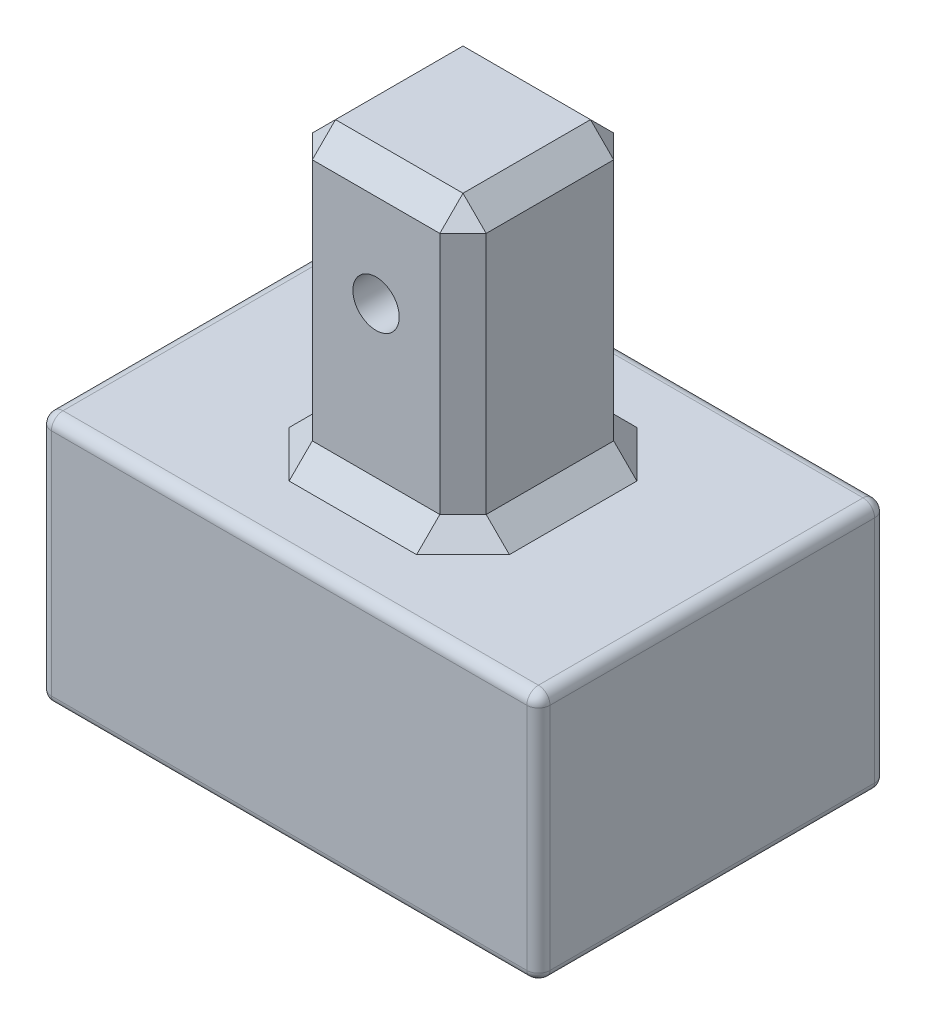
from build123d import *

# Parameters (mm, degrees)
MAIN_BODY_EXTRUDE_DEPTH        = 19.05
HINGE_START                    = -26.043353817
HINGE_SHELL_OUTLINE_W          = 26.043353817
HINGE_SHELL_OUTLINE_H          = 33.02
HINGE_SHELL_DEPTH              = 52.086707634
GROOVE_START                   = -16.51
GROOVE_1_DEPTH                 = 1.27
GROOVE_START_2                 = 17.78
GROOVE_2_DEPTH                 = 1.27
SKETCH5_W                      = 19.05
SKETCH5_H                      = 19.05
TIBIA_CONNECTION_EXTRUDE_DEPTH = 31.75
SKETCH6_R                      = 2.54
PINHOLE_CUT_DEPTH              = 25.4
FILLET1_R                      = 1.27
CHAMFER1_SIZE                  = 2.54
FILLET2_R                      = 0.889


# Read off the part's stored shape, not the designer's step: Hinge Shell
with BuildPart() as part:
    # Sketch1 → Main Body Extrude (new, symmetric)
    with BuildSketch(Plane.XY):
        with BuildLine():
            Line((18.423353817, 0), (-18.423353817, 0))
            ThreePointArc((-18.423353817, 0), (0, 18.423353817), (18.423353817, 0))
        make_face()
        with BuildLine():
            Line((18.423353817, 0), (21.598353817, 0))
            ThreePointArc((21.598353817, 0), (0, 21.598353817), (-21.598353817, 0))
            Line((-21.598353817, 0), (-18.423353817, 0))
            ThreePointArc((-18.423353817, 0), (0, 18.423353817), (18.423353817, 0))
        make_face()
        with BuildLine():
            Line((24.138353817, 0), (21.598353817, 0))
            ThreePointArc((21.598353817, 0), (0, 21.598353817), (-21.598353817, 0))
            Line((-21.598353817, 0), (-24.138353817, 0))
            ThreePointArc((-24.138353817, 0), (0, 24.138353817), (24.138353817, 0))
        make_face()
        with BuildLine():
            ThreePointArc((24.138353817, 0), (0, 24.138353817), (-24.138353817, 0))
            Line((-24.138353817, 0), (-24.773353817, 0))
            ThreePointArc((-24.773353817, 0), (0, 24.773353817), (24.773353817, 0))
            Line((24.773353817, 0), (24.138353817, 0))
        make_face()
        with BuildLine():
            Line((27.313353817, 0), (24.773353817, 0))
            ThreePointArc((24.773353817, 0), (0, 24.773353817), (-24.773353817, 0))
            Line((-24.773353817, 0), (-27.313353817, 0))
            ThreePointArc((-27.313353817, 0), (0, 27.313353817), (27.313353817, 0))
        make_face()
        with BuildLine():
            Line((-27.313353817, 27.313353817), (-27.313353817, 0))
            ThreePointArc((-27.313353817, 0), (-19.313457701, 19.313457701), (0, 27.313353817))
            Line((0, 27.313353817), (-27.313353817, 27.313353817))
        make_face()
        with BuildLine():
            Line((27.313353817, 27.313353817), (0, 27.313353817))
            ThreePointArc((0, 27.313353817), (19.313457701, 19.313457701), (27.313353817, 0))
            Line((27.313353817, 0), (27.313353817, 27.313353817))
        make_face()
    extrude(amount=MAIN_BODY_EXTRUDE_DEPTH, both=True)

    # Hinge Shell outline → Hinge Shell (cut)
    with BuildSketch(Plane.YZ.offset(HINGE_START)):
        with Locations((13.021676908, 0)):
            Rectangle(HINGE_SHELL_OUTLINE_W, HINGE_SHELL_OUTLINE_H)
    extrude(amount=HINGE_SHELL_DEPTH, mode=Mode.SUBTRACT)

    # Sketch1<13> → Groove 1 (cut)
    with BuildSketch(Plane.XY.offset(GROOVE_START)):
        with BuildLine():
            Line((18.423353817, 0), (21.598353817, 0))
            ThreePointArc((21.598353817, 0), (0, 21.598353817), (-21.598353817, 0))
            Line((-21.598353817, 0), (-18.423353817, 0))
            ThreePointArc((-18.423353817, 0), (0, 18.423353817), (18.423353817, 0))
        make_face()
    extrude(amount=-GROOVE_1_DEPTH, mode=Mode.SUBTRACT)

    # Sketch1<14> → Groove 2 (cut)
    with BuildSketch(Plane.XY.offset(GROOVE_START_2)):
        with BuildLine():
            Line((18.423353817, 0), (21.598353817, 0))
            ThreePointArc((21.598353817, 0), (0, 21.598353817), (-21.598353817, 0))
            Line((-21.598353817, 0), (-18.423353817, 0))
            ThreePointArc((-18.423353817, 0), (0, 18.423353817), (18.423353817, 0))
        make_face()
    extrude(amount=-GROOVE_2_DEPTH, mode=Mode.SUBTRACT)

    # Sketch5 → Tibia Connection Extrude (add)
    with BuildSketch(Plane(origin=(0, 27.313353817, 0), x_dir=(1, 0, 0), z_dir=(0, 1, 0))):
        Rectangle(SKETCH5_W, SKETCH5_H)
    extrude(amount=TIBIA_CONNECTION_EXTRUDE_DEPTH)

    # Sketch6 → Pinhole Cut (cut)
    with BuildSketch(Plane.XY.offset(9.525)):
        with Locations((0, 46.363353817)):
            Circle(SKETCH6_R)
    extrude(amount=-PINHOLE_CUT_DEPTH, mode=Mode.SUBTRACT)

    # Fillet1
    fillet1_edges = [part.edges().sort_by_distance(p)[0] for p in [
        (-27.313353817, 27.313353817, 0),
        (27.313353817, 27.313353817, 0),
        (27.313353817, 13.656676909, 19.05),
        (0, 27.313353817, 19.05),
        (-27.313353817, 13.656676909, 19.05),
        (-27.313353817, 13.656676909, -19.05),
        (0, 27.313353817, -19.05),
        (27.313353817, 13.656676909, -19.05),
    ]]
    fillet(fillet1_edges, radius=FILLET1_R)

    # Chamfer1
    chamfer1_edges = [part.edges().sort_by_distance(p)[0] for p in [
        (0, 27.313353817, 9.525),
        (-9.525, 43.188353817, 9.525),
        (9.525, 27.313353817, 0),
        (9.525, 43.188353817, 9.525),
        (0, 59.063353817, -9.525),
        (9.525, 43.188353817, -9.525),
        (-9.525, 59.063353817, 0),
        (-9.525, 43.188353817, -9.525),
        (0, 59.063353817, 9.525),
        (9.525, 59.063353817, 0),
        (-9.525, 27.313353817, 0),
        (0, 27.313353817, -9.525),
    ]]
    chamfer(chamfer1_edges, length=CHAMFER1_SIZE)

    # Fillet2
    fillet2_edges = [part.edges().sort_by_distance(p)[0] for p in [
        (26.941379429, 0, -18.678025612),
        (0, 0, -19.05),
        (27.313353817, 0, 0),
        (0, 0, 19.05),
        (-27.313353817, 0, 0),
        (26.941379429, 0, 18.678025612),
        (-26.941379429, 0, 18.678025612),
        (-26.941379429, 0, -18.678025612),
    ]]
    fillet(fillet2_edges, radius=FILLET2_R)


solid = part.part
